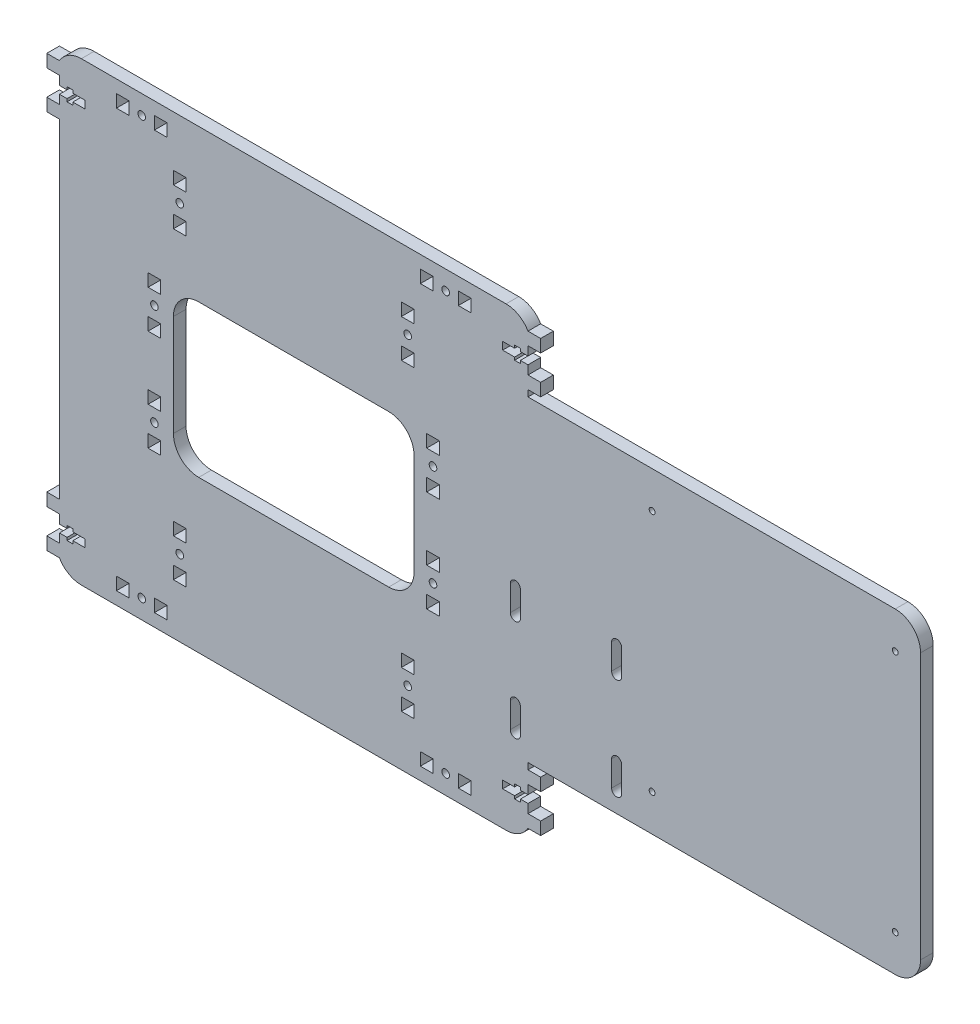
from build123d import *

# Parameters (mm, degrees)
SKETCH1_R           = 1.15
SKETCH1_R_2         = 1.5
SKETCH1_W           = 95
SKETCH1_H           = 60
SKETCH1_W_2         = 5
SKETCH1_H_2         = 5
BOSS_EXTRUDE1_DEPTH = 5
FILLET1_R           = 10


with BuildPart() as part:
    # Sketch1 → Boss-Extrude1 (new body)
    with BuildSketch(Plane.XY):
        Polygon((-92.5, 90), (92.5, 90), (92.5, 85), (97.5, 85), (97.5, 80), (92.5, 80), (92.5, 76.5), (89.5, 76.5), (89.5, 77.6), (87.2, 77.6), (87.2, 76.5), (82.5, 76.5), (82.5, 73.5), (87.2, 73.5), (87.2, 72.4), (89.5, 72.4), (89.5, 73.5), (92.5, 73.5), (92.5, 70), (97.5, 70), (97.5, 65), (92.5, 65), (92.5, 62.5), (247.5, 62.5), (247.5, -62.5), (92.5, -62.5), (92.5, -65), (97.5, -65), (97.5, -70), (92.5, -70), (92.5, -73.5), (89.5, -73.5), (89.5, -72.4), (87.2, -72.4), (87.2, -73.5), (82.5, -73.5), (82.5, -76.5), (87.2, -76.5), (87.2, -77.6), (89.5, -77.6), (89.5, -76.5), (92.5, -76.5), (92.5, -80), (97.5, -80), (97.5, -85), (92.5, -85), (92.5, -90), (-92.5, -90), (-92.5, -85), (-97.5, -85), (-97.5, -80), (-92.5, -80), (-92.5, -76.5), (-89.5, -76.5), (-89.5, -77.6), (-87.2, -77.6), (-87.2, -76.5), (-82.5, -76.5), (-82.5, -73.5), (-87.2, -73.5), (-87.2, -72.4), (-89.5, -72.4), (-89.5, -73.5), (-92.5, -73.5), (-92.5, -70), (-97.5, -70), (-97.5, -65), (-92.5, -65), (-92.5, 65), (-97.5, 65), (-97.5, 70), (-92.5, 70), (-92.5, 73.5), (-89.5, 73.5), (-89.5, 72.4), (-87.2, 72.4), (-87.2, 73.5), (-82.5, 73.5), (-82.5, 76.5), (-87.2, 76.5), (-87.2, 77.6), (-89.5, 77.6), (-89.5, 76.5), (-92.5, 76.5), (-92.5, 80), (-97.5, 80), (-97.5, 85), (-92.5, 85), align=None)
        with Locations((141.5, 48)):
            Circle(SKETCH1_R, mode=Mode.SUBTRACT)
        with Locations((237.5, 48)):
            Circle(SKETCH1_R, mode=Mode.SUBTRACT)
        with Locations((237.5, -48)):
            Circle(SKETCH1_R, mode=Mode.SUBTRACT)
        with Locations((141.5, -48)):
            Circle(SKETCH1_R, mode=Mode.SUBTRACT)
        with Locations((-60, 82.5)):
            Circle(SKETCH1_R_2, mode=Mode.SUBTRACT)
        with Locations(Location((60, 82.5, 0), (0, 0, 180))):
            Circle(SKETCH1_R_2, mode=Mode.SUBTRACT)
        with Locations((60, -82.5)):
            Circle(SKETCH1_R_2, mode=Mode.SUBTRACT)
        with Locations(Location((-60, -82.5, 0), (0, 0, 90))):
            Circle(SKETCH1_R_2, mode=Mode.SUBTRACT)
        with Locations((55, 20)):
            Circle(SKETCH1_R_2, mode=Mode.SUBTRACT)
        with Locations(Location((-55, 20, 0), (0, 0, 180))):
            Circle(SKETCH1_R_2, mode=Mode.SUBTRACT)
        with Locations(Location((55, -20, 0), (0, 0, 90))):
            Circle(SKETCH1_R_2, mode=Mode.SUBTRACT)
        with Locations((-55, -20)):
            Circle(SKETCH1_R_2, mode=Mode.SUBTRACT)
        with Locations((45, 60)):
            Circle(SKETCH1_R_2, mode=Mode.SUBTRACT)
        with Locations(Location((-45, 60, 0), (0, 0, 180))):
            Circle(SKETCH1_R_2, mode=Mode.SUBTRACT)
        with Locations(Location((45, -60, 0), (0, 0, 90))):
            Circle(SKETCH1_R_2, mode=Mode.SUBTRACT)
        with Locations((-45, -60)):
            Circle(SKETCH1_R_2, mode=Mode.SUBTRACT)
        Rectangle(SKETCH1_W, SKETCH1_H, mode=Mode.SUBTRACT)
        with BuildLine():
            Line((125.5, -14.75), (125.5, -4.75))
            ThreePointArc((125.5, -4.75), (127.5, -2.75), (129.5, -4.75))
            Line((129.5, -4.75), (129.5, -14.75))
            ThreePointArc((129.5, -14.75), (127.5, -16.75), (125.5, -14.75))
        make_face(mode=Mode.SUBTRACT)
        with BuildLine():
            Line((85.5, -14.75), (85.5, -4.75))
            ThreePointArc((85.5, -4.75), (87.5, -2.75), (89.5, -4.75))
            Line((89.5, -4.75), (89.5, -14.75))
            ThreePointArc((89.5, -14.75), (87.5, -16.75), (85.5, -14.75))
        make_face(mode=Mode.SUBTRACT)
        with BuildLine():
            Line((85.5, -54.75), (85.5, -44.75))
            ThreePointArc((85.5, -44.75), (87.5, -42.75), (89.5, -44.75))
            Line((89.5, -44.75), (89.5, -54.75))
            ThreePointArc((89.5, -54.75), (87.5, -56.75), (85.5, -54.75))
        make_face(mode=Mode.SUBTRACT)
        with BuildLine():
            Line((125.5, -54.75), (125.5, -44.75))
            ThreePointArc((125.5, -44.75), (127.5, -42.75), (129.5, -44.75))
            Line((129.5, -44.75), (129.5, -54.75))
            ThreePointArc((129.5, -54.75), (127.5, -56.75), (125.5, -54.75))
        make_face(mode=Mode.SUBTRACT)
        with Locations((-67.5, 82.5)):
            Rectangle(SKETCH1_W_2, SKETCH1_H_2, mode=Mode.SUBTRACT)
        with Locations((-52.5, 82.5)):
            Rectangle(SKETCH1_W_2, SKETCH1_H_2, mode=Mode.SUBTRACT)
        with Locations((67.5, 82.5)):
            Rectangle(SKETCH1_W_2, SKETCH1_H_2, mode=Mode.SUBTRACT)
        with Locations((52.5, 82.5)):
            Rectangle(SKETCH1_W_2, SKETCH1_H_2, mode=Mode.SUBTRACT)
        with Locations((67.5, -82.5)):
            Rectangle(SKETCH1_W_2, SKETCH1_H_2, mode=Mode.SUBTRACT)
        with Locations((52.5, -82.5)):
            Rectangle(SKETCH1_W_2, SKETCH1_H_2, mode=Mode.SUBTRACT)
        with Locations((-67.5, -82.5)):
            Rectangle(SKETCH1_W_2, SKETCH1_H_2, mode=Mode.SUBTRACT)
        with Locations((-52.5, -82.5)):
            Rectangle(SKETCH1_W_2, SKETCH1_H_2, mode=Mode.SUBTRACT)
        with Locations((55, 27.5)):
            Rectangle(SKETCH1_W_2, SKETCH1_H_2, mode=Mode.SUBTRACT)
        with Locations((55, 12.5)):
            Rectangle(SKETCH1_W_2, SKETCH1_H_2, mode=Mode.SUBTRACT)
        with Locations((-55, 27.5)):
            Rectangle(SKETCH1_W_2, SKETCH1_H_2, mode=Mode.SUBTRACT)
        with Locations((-55, 12.5)):
            Rectangle(SKETCH1_W_2, SKETCH1_H_2, mode=Mode.SUBTRACT)
        with Locations((55, -27.5)):
            Rectangle(SKETCH1_W_2, SKETCH1_H_2, mode=Mode.SUBTRACT)
        with Locations((55, -12.5)):
            Rectangle(SKETCH1_W_2, SKETCH1_H_2, mode=Mode.SUBTRACT)
        with Locations((-55, -27.5)):
            Rectangle(SKETCH1_W_2, SKETCH1_H_2, mode=Mode.SUBTRACT)
        with Locations((-55, -12.5)):
            Rectangle(SKETCH1_W_2, SKETCH1_H_2, mode=Mode.SUBTRACT)
        with Locations((45, 67.5)):
            Rectangle(SKETCH1_W_2, SKETCH1_H_2, mode=Mode.SUBTRACT)
        with Locations((45, 52.5)):
            Rectangle(SKETCH1_W_2, SKETCH1_H_2, mode=Mode.SUBTRACT)
        with Locations((-45, 67.5)):
            Rectangle(SKETCH1_W_2, SKETCH1_H_2, mode=Mode.SUBTRACT)
        with Locations((-45, 52.5)):
            Rectangle(SKETCH1_W_2, SKETCH1_H_2, mode=Mode.SUBTRACT)
        with Locations((45, -67.5)):
            Rectangle(SKETCH1_W_2, SKETCH1_H_2, mode=Mode.SUBTRACT)
        with Locations((45, -52.5)):
            Rectangle(SKETCH1_W_2, SKETCH1_H_2, mode=Mode.SUBTRACT)
        with Locations((-45, -67.5)):
            Rectangle(SKETCH1_W_2, SKETCH1_H_2, mode=Mode.SUBTRACT)
        with Locations((-45, -52.5)):
            Rectangle(SKETCH1_W_2, SKETCH1_H_2, mode=Mode.SUBTRACT)
    extrude(amount=BOSS_EXTRUDE1_DEPTH)

    # Fillet1
    # the kernel refuses this fillet: 10 mm, written as the material it adds along each edge
    with BuildSketch(Plane(origin=(47.5, -30, 0), x_dir=(-1, 0, 0), z_dir=(0, 0, 1)), Plane(origin=(-47.5, -30, 0), x_dir=(0, 1, 0), z_dir=(0, 0, 1)), Plane(origin=(47.5, 30, 0), x_dir=(0, -1, 0), z_dir=(0, 0, 1))) as fillet1_piece_1:
        with BuildLine():
            CenterArc((FILLET1_R, -FILLET1_R), FILLET1_R, 90, 90)
            Line((0, -FILLET1_R), (0, 0))
            Line((0, 0), (FILLET1_R, 0))
        make_face()
    extrude(amount=5)
    with BuildSketch(Plane(origin=(-47.5, 30, 0), x_dir=(0, -1, 0), z_dir=(0, 0, 1))) as fillet1_piece_2:
        with BuildLine():
            CenterArc((FILLET1_R, FILLET1_R), FILLET1_R, 180, 90)
            Line((0, FILLET1_R), (0, 0))
            Line((0, 0), (FILLET1_R, 0))
        make_face()
    extrude(amount=5)
    # the kernel refuses this fillet: 10 mm, written as the material it takes off along each edge
    with BuildSketch(Plane(origin=(-92.5, 90, -21.650635095), x_dir=(1, 0, 0), z_dir=(0, 0, 1))) as fillet1_2_piece_1:
        with BuildLine():
            CenterArc((8.660254038, -10), FILLET1_R, 90, 60)
            Line((0, -5), (0, 0))
            Line((0, 0), (8.660254038, 0))
        make_face()
    extrude(amount=48.301270189, mode=Mode.SUBTRACT)
    with BuildSketch(Plane(origin=(-92.5, -90, -21.650635095), x_dir=(1, 0, 0), z_dir=(0, 0, 1)), Plane(origin=(92.5, 90, -21.650635095), x_dir=(-1, 0, 0), z_dir=(0, 0, 1))) as fillet1_2_piece_2:
        with BuildLine():
            CenterArc((8.660254038, 10), FILLET1_R, 210, 60)
            Line((0, 5), (0, 0))
            Line((0, 0), (8.660254038, 0))
        make_face()
    extrude(amount=48.301270189, mode=Mode.SUBTRACT)
    with BuildSketch(Plane(origin=(92.5, -90, -21.650635095), x_dir=(0, 1, 0), z_dir=(0, 0, 1))) as fillet1_2_piece_3:
        with BuildLine():
            CenterArc((10, 8.660254038), FILLET1_R, 180, 60)
            Line((0, 8.660254038), (0, 0))
            Line((0, 0), (5, 0))
        make_face()
    extrude(amount=48.301270189, mode=Mode.SUBTRACT)
    with BuildSketch(Plane(origin=(247.5, -62.5, -25), x_dir=(0, 1, 0), z_dir=(0, 0, 1)), Plane(origin=(247.5, 62.5, -25), x_dir=(-1, 0, 0), z_dir=(0, 0, 1))) as fillet1_2_piece_4:
        with BuildLine():
            CenterArc((FILLET1_R, FILLET1_R), FILLET1_R, 180, 90)
            Line((0, FILLET1_R), (0, 0))
            Line((0, 0), (FILLET1_R, 0))
        make_face()
    extrude(amount=55, mode=Mode.SUBTRACT)


solid = part.part
